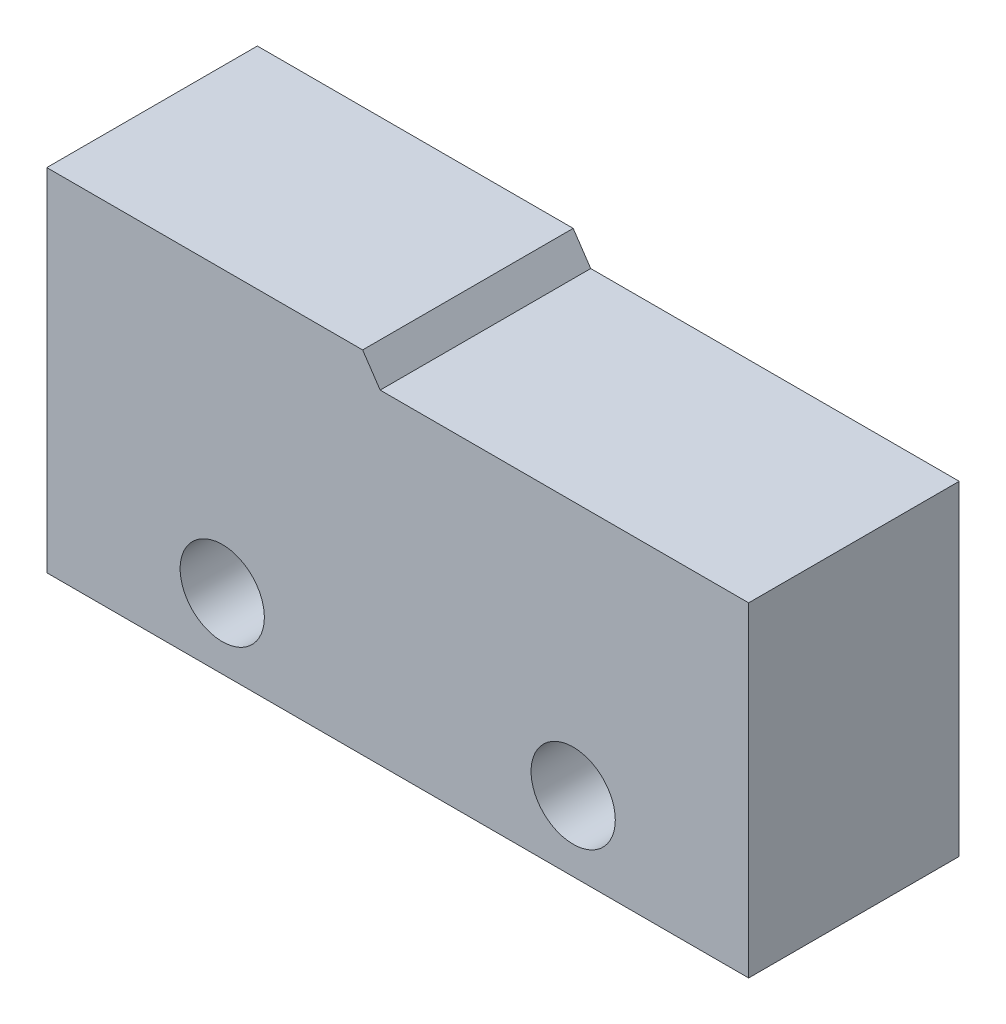
from build123d import *

# Parameters (mm, degrees)
SKETCH1_R           = 1.2
BOSS_EXTRUDE1_DEPTH = 6


with BuildPart() as part:
    # Sketch1 → Boss-Extrude1 (new body)
    with BuildSketch(Plane.XY):
        Polygon((-0.5, 4.258314247), (-1, 5), (-10, 5), (-10, -5), (10, -5), (10, 4.258314247), align=None)
        with Locations((-5, -3)):
            Circle(SKETCH1_R, mode=Mode.SUBTRACT)
        with Locations((5, -3)):
            Circle(SKETCH1_R, mode=Mode.SUBTRACT)
    extrude(amount=BOSS_EXTRUDE1_DEPTH)


solid = part.part
